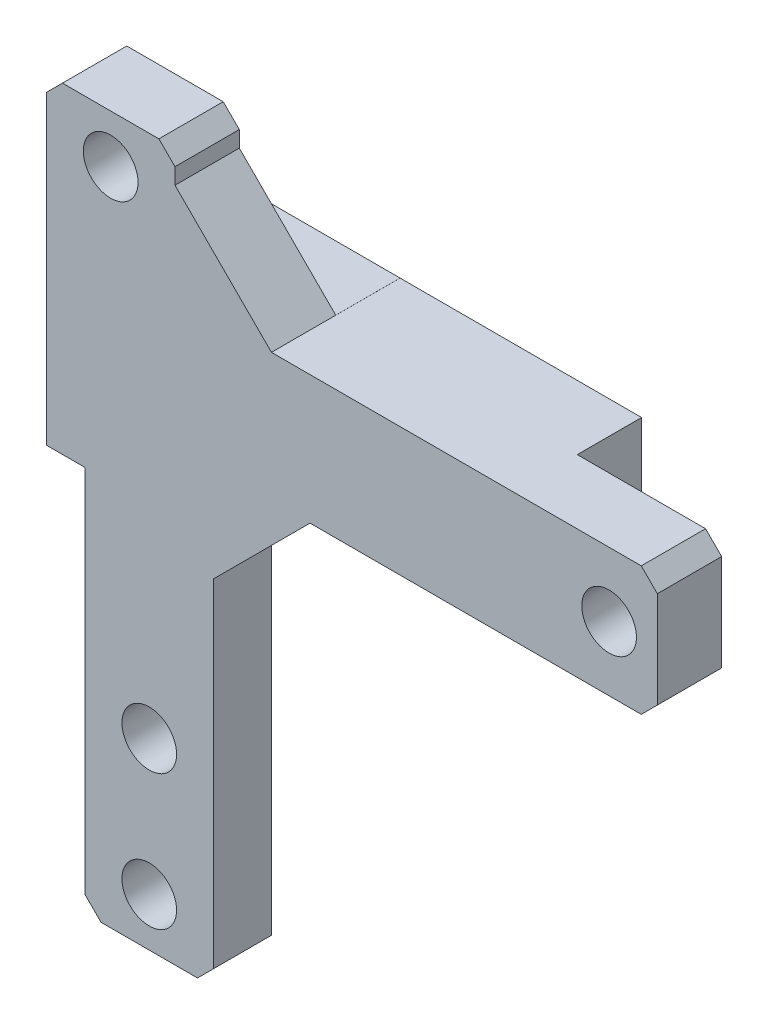
from build123d import *

# Parameters (mm, degrees)
SKETCH_1_R          = 0.85
EXTRUDE_1_DEPTH     = 4
SKETCH_2_W          = 4
SKETCH_2_H          = 11.631287185
SKETCH_2_R          = 0.85
CUT_EXTRUDE_1_DEPTH = 2.2
SKETCH_3_W          = 4.48994314
SKETCH_3_H          = 4
SKETCH_3_R          = 0.85
SKETCH_3_W_2        = 4
SKETCH_3_H_2        = 3.998874997
CUT_EXTRUDE_2_DEPTH = 2
CHAMFER_1_SIZE      = 3
CHAMFER_2_SIZE      = 0.5


with BuildPart() as part:
    # 草图1 → 凸台-拉伸1 (new body)
    with BuildSketch(Plane.XY):
        Polygon((-4.3, -2.5), (9.5, -2.5), (9.5, 1.5), (-5.5, 1.5), (-5.5, 5.5), (-9.5, 5.5), (-9.5, 1.5), (-9.5, -4.5), (-8.3, -4.5), (-8.3, -16.5), (-4.3, -16.5), align=None)
        with Locations((8, -0.5)):
            Circle(SKETCH_1_R, mode=Mode.SUBTRACT)
        with Locations((-7.5, 4)):
            Circle(SKETCH_1_R, mode=Mode.SUBTRACT)
        with Locations((-6.3, -15)):
            Circle(SKETCH_1_R, mode=Mode.SUBTRACT)
        with Locations((-6.3, -10.8)):
            Circle(SKETCH_1_R, mode=Mode.SUBTRACT)
    extrude(amount=EXTRUDE_1_DEPTH)

    # 草图2 → 切除-拉伸1 (cut)
    with BuildSketch(Plane.XY):
        with Locations((-6.3, -10.684356408)):
            Rectangle(SKETCH_2_W, SKETCH_2_H)
        with Locations((-6.3, -15)):
            Circle(SKETCH_2_R, mode=Mode.SUBTRACT)
        with Locations((-6.3, -10.8)):
            Circle(SKETCH_2_R, mode=Mode.SUBTRACT)
    extrude(amount=CUT_EXTRUDE_1_DEPTH, mode=Mode.SUBTRACT)

    # 草图3 → 切除-拉伸2 (cut)
    # profile 1 of 2: a face of its own
    with BuildSketch(Plane(origin=(0, 0, 0), x_dir=(-1, 0, 0), z_dir=(0, 0, -1))):
        with Locations((-7.25502843, -0.5)):
            Rectangle(SKETCH_3_W, SKETCH_3_H)
        with Locations((-8, -0.5)):
            Circle(SKETCH_3_R, mode=Mode.SUBTRACT)
    # profile 2 of 2: a face of its own
    with BuildSketch(Plane(origin=(0, 0, 0), x_dir=(-1, 0, 0), z_dir=(0, 0, -1))):
        with Locations((7.5, 3.500562502)):
            Rectangle(SKETCH_3_W_2, SKETCH_3_H_2)
        with Locations((7.5, 4)):
            Circle(SKETCH_3_R, mode=Mode.SUBTRACT)
    extrude(amount=-CUT_EXTRUDE_2_DEPTH, mode=Mode.SUBTRACT)

    # 倒角1
    chamfer_1_edges = [part.edges().sort_by_distance(p)[0] for p in [
        (-4.3, -2.5, 2),
        (-5.5, 1.5, 2),
    ]]
    chamfer(chamfer_1_edges, length=CHAMFER_1_SIZE)

    # 倒角2
    chamfer_2_edges = [part.edges().sort_by_distance(p)[0] for p in [
        (-4.3, -16.5, 3.1),
        (-8.3, -16.5, 3.1),
        (-9.5, 5.5, 3),
        (9.5, -2.5, 3),
        (9.5, 1.5, 3),
        (-5.5, 5.5, 3),
    ]]
    chamfer(chamfer_2_edges, length=CHAMFER_2_SIZE)


solid = part.part
